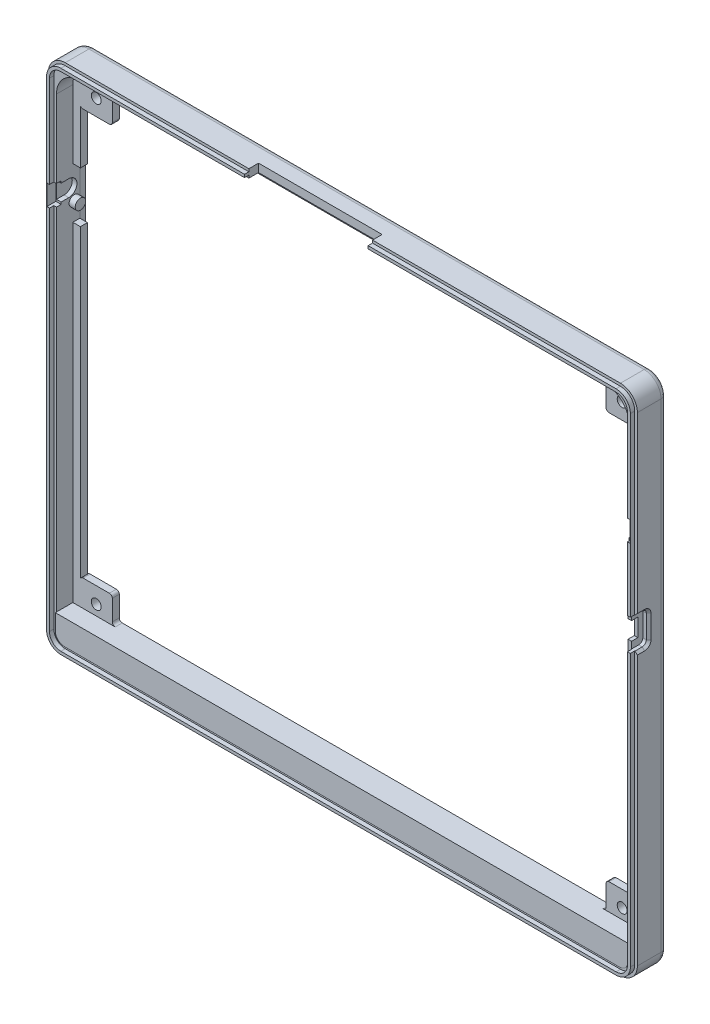
from build123d import *

# Parameters (mm, degrees)
PERIMETER_SHELL_START                     = -7.6
PERIMETER_SHELL_DEPTH                     = 5.6
OPEN_BACK_FRAME_START                     = -12.1
OPEN_BACK_FRAME_DEPTH                     = 4.5
PCB_MOUNT_WEB_0_START                     = -12.1
PCB_MOUNT_WEB_0_DEPTH                     = 4.5
PCB_M3_THROUGH_0_START                    = -7.5
PCB_M3_THROUGH_0_PROFILE_R                = 1.7
PCB_M3_THROUGH_0_DEPTH                    = 4.7
PCB_MOUNT_WEB_1_START                     = -12.1
PCB_MOUNT_WEB_1_DEPTH                     = 4.5
PCB_M3_THROUGH_1_START                    = -7.5
PCB_M3_THROUGH_1_PROFILE_R                = 1.7
PCB_M3_THROUGH_1_DEPTH                    = 4.7
PCB_MOUNT_WEB_2_START                     = -12.1
PCB_MOUNT_WEB_2_DEPTH                     = 4.5
PCB_M3_THROUGH_2_START                    = -7.5
PCB_M3_THROUGH_2_PROFILE_R                = 1.7
PCB_M3_THROUGH_2_DEPTH                    = 4.7
PCB_MOUNT_WEB_3_START                     = -12.1
PCB_MOUNT_WEB_3_DEPTH                     = 4.5
PCB_M3_THROUGH_3_START                    = -7.5
PCB_M3_THROUGH_3_PROFILE_R                = 1.7
PCB_M3_THROUGH_3_DEPTH                    = 4.7
REAR_GLASS_SEAT_START                     = -10
REAR_GLASS_SEAT_DEPTH                     = 2.2
PCB_LOWER_EDGE_WEB_START                  = -10
PCB_LOWER_EDGE_WEB_PROFILE_W              = 191
PCB_LOWER_EDGE_WEB_PROFILE_H              = 8.3
PCB_LOWER_EDGE_WEB_DEPTH                  = 8.4
PCB_SUPPORT_ROOT_ROUND_R                  = 1
LOCATING_TONGUE_START                     = -2
LOCATING_TONGUE_DEPTH                     = 1.5
TOP_CONNECTOR_ACCESS_START                = 14.29999894
TOP_CONNECTOR_ACCESS_PROFILE_W            = 42.3
TOP_CONNECTOR_ACCESS_PROFILE_H            = 13.3
TOP_CONNECTOR_ACCESS_DEPTH                = 19.6
POWER_RETAINING_WEB_START                 = -5.85
POWER_RETAINING_WEB_PROFILE_W             = 0.6
POWER_RETAINING_WEB_PROFILE_H             = 13.5
POWER_RETAINING_WEB_DEPTH                 = 3.85
SLIDER_SLOT_START                         = -0.35
SLIDER_SLOT_PROFILE_W                     = 7.8
SLIDER_SLOT_PROFILE_H                     = 6.1
SLIDER_SLOT_DEPTH                         = 3.8
POWER_THUMB_RECESS_START                  = 193.8
POWER_THUMB_RECESS_DEPTH                  = 3.4
INTERNAL_HINGE_CLEARANCE_0_START          = -1.9
INTERNAL_HINGE_CLEARANCE_0_PROFILE_W      = 7.2
INTERNAL_HINGE_CLEARANCE_0_PROFILE_H      = 17.4
INTERNAL_HINGE_CLEARANCE_0_DEPTH          = 10.3
INTERNAL_STOP_PIN_0_START                 = -3.5
INTERNAL_STOP_PIN_0_PROFILE_R             = 1.8
INTERNAL_STOP_PIN_0_DEPTH                 = 2.6
BLIND_AXLE_BEARING_0_START                = -4.6
BLIND_AXLE_BEARING_0_PROFILE_R            = 2.8
BLIND_AXLE_BEARING_0_DEPTH                = 1.7
AXLE_ASSEMBLY_ENTRY_0_START               = -4.6
AXLE_ASSEMBLY_ENTRY_0_PROFILE_W           = 6.3
AXLE_ASSEMBLY_ENTRY_0_PROFILE_H           = 5.6
AXLE_ASSEMBLY_ENTRY_0_DEPTH               = 1.7
KEEPER_SEAT_0_START                       = 0.1
KEEPER_SEAT_0_PROFILE_W                   = 2.1
KEEPER_SEAT_0_PROFILE_H                   = 7
KEEPER_SEAT_0_DEPTH                       = 3.7
INTERNAL_HINGE_CLEARANCE_1_START          = -1.9
INTERNAL_HINGE_CLEARANCE_1_PROFILE_W      = 7.2
INTERNAL_HINGE_CLEARANCE_1_PROFILE_H      = 17.4
INTERNAL_HINGE_CLEARANCE_1_DEPTH          = 10.3
INTERNAL_STOP_PIN_1_START                 = 190.9
INTERNAL_STOP_PIN_1_PROFILE_R             = 1.8
INTERNAL_STOP_PIN_1_DEPTH                 = 2.6
BLIND_AXLE_BEARING_1_START                = 192.9
BLIND_AXLE_BEARING_1_PROFILE_R            = 2.8
BLIND_AXLE_BEARING_1_DEPTH                = 1.7
AXLE_ASSEMBLY_ENTRY_1_START               = 192.9
AXLE_ASSEMBLY_ENTRY_1_PROFILE_W           = 6.3
AXLE_ASSEMBLY_ENTRY_1_PROFILE_H           = 5.6
AXLE_ASSEMBLY_ENTRY_1_DEPTH               = 1.7
KEEPER_SEAT_1_START                       = 0.1
KEEPER_SEAT_1_PROFILE_W                   = 2.1
KEEPER_SEAT_1_PROFILE_H                   = 7
KEEPER_SEAT_1_DEPTH                       = 3.7
OUTER_REAR_ROUND_R                        = 2
REAR_CORNER_FILL_0_START                  = -7.6
REAR_CORNER_FILL_0_PROFILE_W              = 9
REAR_CORNER_FILL_0_PROFILE_H              = 9
REAR_CORNER_FILL_0_DEPTH                  = 5.2
REAR_CORNER_RADIUS_0_START                = -2.3
REAR_CORNER_RADIUS_0_PROFILE_R            = 8
REAR_CORNER_RADIUS_0_DEPTH                = 5.3
REAR_CORNER_FILL_1_START                  = -7.6
REAR_CORNER_FILL_1_PROFILE_W              = 9
REAR_CORNER_FILL_1_PROFILE_H              = 9
REAR_CORNER_FILL_1_DEPTH                  = 5.2
REAR_CORNER_RADIUS_1_START                = -2.3
REAR_CORNER_RADIUS_1_PROFILE_R            = 8
REAR_CORNER_RADIUS_1_DEPTH                = 5.3
REAR_CORNER_FILL_2_START                  = -7.6
REAR_CORNER_FILL_2_PROFILE_W              = 9
REAR_CORNER_FILL_2_PROFILE_H              = 9
REAR_CORNER_FILL_2_DEPTH                  = 5.2
REAR_CORNER_RADIUS_2_START                = -2.3
REAR_CORNER_RADIUS_2_PROFILE_R            = 8
REAR_CORNER_RADIUS_2_DEPTH                = 5.3
REAR_CORNER_FILL_3_START                  = -7.6
REAR_CORNER_FILL_3_PROFILE_W              = 9
REAR_CORNER_FILL_3_PROFILE_H              = 9
REAR_CORNER_FILL_3_DEPTH                  = 5.2
REAR_CORNER_RADIUS_3_START                = -2.3
REAR_CORNER_RADIUS_3_PROFILE_R            = 8
REAR_CORNER_RADIUS_3_DEPTH                = 5.3
CORNER_LOWER_PCB_SUPPORT_START            = -10
CORNER_LOWER_PCB_SUPPORT_PROFILE_W        = 191
CORNER_LOWER_PCB_SUPPORT_PROFILE_H        = 8.3
CORNER_LOWER_PCB_SUPPORT_DEPTH            = 8.4
REAR_CORNER_FILL_0_EDGE_FLUSH_START       = -7.6
REAR_CORNER_FILL_0_EDGE_FLUSH_PROFILE_W   = 9
REAR_CORNER_FILL_0_EDGE_FLUSH_PROFILE_H   = 9
REAR_CORNER_FILL_0_EDGE_FLUSH_DEPTH       = 5.6
REAR_CORNER_RADIUS_0_EDGE_FLUSH_START     = -1.9
REAR_CORNER_RADIUS_0_EDGE_FLUSH_PROFILE_R = 8
REAR_CORNER_RADIUS_0_EDGE_FLUSH_DEPTH     = 5.7
REAR_CORNER_FILL_1_EDGE_FLUSH_START       = -7.6
REAR_CORNER_FILL_1_EDGE_FLUSH_PROFILE_W   = 9
REAR_CORNER_FILL_1_EDGE_FLUSH_PROFILE_H   = 9
REAR_CORNER_FILL_1_EDGE_FLUSH_DEPTH       = 5.6
REAR_CORNER_RADIUS_1_EDGE_FLUSH_START     = -1.9
REAR_CORNER_RADIUS_1_EDGE_FLUSH_PROFILE_R = 8
REAR_CORNER_RADIUS_1_EDGE_FLUSH_DEPTH     = 5.7
REAR_CORNER_FILL_2_EDGE_FLUSH_START       = -7.6
REAR_CORNER_FILL_2_EDGE_FLUSH_PROFILE_W   = 9
REAR_CORNER_FILL_2_EDGE_FLUSH_PROFILE_H   = 9
REAR_CORNER_FILL_2_EDGE_FLUSH_DEPTH       = 5.6
REAR_CORNER_RADIUS_2_EDGE_FLUSH_START     = -1.9
REAR_CORNER_RADIUS_2_EDGE_FLUSH_PROFILE_R = 8
REAR_CORNER_RADIUS_2_EDGE_FLUSH_DEPTH     = 5.7
REAR_CORNER_FILL_3_EDGE_FLUSH_START       = -7.6
REAR_CORNER_FILL_3_EDGE_FLUSH_PROFILE_W   = 9
REAR_CORNER_FILL_3_EDGE_FLUSH_PROFILE_H   = 9
REAR_CORNER_FILL_3_EDGE_FLUSH_DEPTH       = 5.6
REAR_CORNER_RADIUS_3_EDGE_FLUSH_START     = -1.9
REAR_CORNER_RADIUS_3_EDGE_FLUSH_PROFILE_R = 8
REAR_CORNER_RADIUS_3_EDGE_FLUSH_DEPTH     = 5.7
PCB_SUPPORT_EDGE_FINISH_START             = -10
PCB_SUPPORT_EDGE_FINISH_DEPTH             = 8.4


with BuildPart() as part:
    # Perimeter_shell_profile → Perimeter_shell (new body)
    with BuildSketch(Plane.XY.offset(PERIMETER_SHELL_START)):
        with BuildLine():
            Line((0, -9.8), (190, -9.8))
            ThreePointArc((190, -9.8), (194.101219331, -8.101219331), (195.8, -4))
            Line((195.8, -4), (195.8, 160))
            ThreePointArc((195.8, 160), (194.101219331, 164.101219331), (190, 165.8))
            Line((190, 165.8), (0, 165.8))
            ThreePointArc((0, 165.8), (-4.101219331, 164.101219331), (-5.8, 160))
            Line((-5.8, 160), (-5.8, -4))
            ThreePointArc((-5.8, -4), (-4.101219331, -8.101219331), (0, -9.8))
        make_face()
        with BuildLine():
            Line((0, -7), (190, -7))
            ThreePointArc((190, -7), (192.121320344, -6.121320344), (193, -4))
            Line((193, -4), (193, 160))
            ThreePointArc((193, 160), (192.121320344, 162.121320344), (190, 163))
            Line((190, 163), (0, 163))
            ThreePointArc((0, 163), (-2.121320344, 162.121320344), (-3, 160))
            Line((-3, 160), (-3, -4))
            ThreePointArc((-3, -4), (-2.121320344, -6.121320344), (0, -7))
        make_face(mode=Mode.SUBTRACT)
    extrude(amount=PERIMETER_SHELL_DEPTH)

    # Open_back_frame_profile → Open_back_frame (add)
    with BuildSketch(Plane.XY.offset(OPEN_BACK_FRAME_START)):
        with BuildLine():
            Line((0, -9.8), (190, -9.8))
            ThreePointArc((190, -9.8), (194.101219331, -8.101219331), (195.8, -4))
            Line((195.8, -4), (195.8, 160))
            ThreePointArc((195.8, 160), (194.101219331, 164.101219331), (190, 165.8))
            Line((190, 165.8), (0, 165.8))
            ThreePointArc((0, 165.8), (-4.101219331, 164.101219331), (-5.8, 160))
            Line((-5.8, 160), (-5.8, -4))
            ThreePointArc((-5.8, -4), (-4.101219331, -8.101219331), (0, -9.8))
        make_face()
        with BuildLine():
            Line((1.6, -4.4), (188.4, -4.4))
            ThreePointArc((188.4, -4.4), (189.814213562, -3.814213562), (190.4, -2.4))
            Line((190.4, -2.4), (190.4, 158.4))
            ThreePointArc((190.4, 158.4), (189.814213562, 159.814213562), (188.4, 160.4))
            Line((188.4, 160.4), (1.6, 160.4))
            ThreePointArc((1.6, 160.4), (0.185786438, 159.814213562), (-0.4, 158.4))
            Line((-0.4, 158.4), (-0.4, -2.4))
            ThreePointArc((-0.4, -2.4), (0.185786438, -3.814213562), (1.6, -4.4))
        make_face(mode=Mode.SUBTRACT)
    extrude(amount=OPEN_BACK_FRAME_DEPTH)

    # PCB_mount_web_0_profile → PCB_mount_web_0 (add)
    with BuildSketch(Plane.XY.offset(PCB_MOUNT_WEB_0_START)):
        with BuildLine():
            Line((0.5, -6), (9.5, -6))
            ThreePointArc((9.5, -6), (10.207106781, -5.707106781), (10.5, -5))
            Line((10.5, -5), (10.5, 9.5))
            ThreePointArc((10.5, 9.5), (10.207106781, 10.207106781), (9.5, 10.5))
            Line((9.5, 10.5), (0.5, 10.5))
            ThreePointArc((0.5, 10.5), (-0.207106781, 10.207106781), (-0.5, 9.5))
            Line((-0.5, 9.5), (-0.5, -5))
            ThreePointArc((-0.5, -5), (-0.207106781, -5.707106781), (0.5, -6))
        make_face()
    extrude(amount=PCB_MOUNT_WEB_0_DEPTH)

    # PCB_M3_through_0_profile → PCB_M3_through_0 (cut)
    with BuildSketch(Plane.XY.offset(PCB_M3_THROUGH_0_START)):
        with Locations((5, 5)):
            Circle(PCB_M3_THROUGH_0_PROFILE_R)
    extrude(amount=-PCB_M3_THROUGH_0_DEPTH, mode=Mode.SUBTRACT)

    # PCB_mount_web_1_profile → PCB_mount_web_1 (add)
    with BuildSketch(Plane.XY.offset(PCB_MOUNT_WEB_1_START)):
        with BuildLine():
            Line((180.5, -6), (189.5, -6))
            ThreePointArc((189.5, -6), (190.207106781, -5.707106781), (190.5, -5))
            Line((190.5, -5), (190.5, 9.5))
            ThreePointArc((190.5, 9.5), (190.207106781, 10.207106781), (189.5, 10.5))
            Line((189.5, 10.5), (180.5, 10.5))
            ThreePointArc((180.5, 10.5), (179.792893219, 10.207106781), (179.5, 9.5))
            Line((179.5, 9.5), (179.5, -5))
            ThreePointArc((179.5, -5), (179.792893219, -5.707106781), (180.5, -6))
        make_face()
    extrude(amount=PCB_MOUNT_WEB_1_DEPTH)

    # PCB_M3_through_1_profile → PCB_M3_through_1 (cut)
    with BuildSketch(Plane.XY.offset(PCB_M3_THROUGH_1_START)):
        with Locations((185, 5)):
            Circle(PCB_M3_THROUGH_1_PROFILE_R)
    extrude(amount=-PCB_M3_THROUGH_1_DEPTH, mode=Mode.SUBTRACT)

    # PCB_mount_web_2_profile → PCB_mount_web_2 (add)
    with BuildSketch(Plane.XY.offset(PCB_MOUNT_WEB_2_START)):
        with BuildLine():
            Line((0.5, 149.5), (9.5, 149.5))
            ThreePointArc((9.5, 149.5), (10.207106781, 149.792893219), (10.5, 150.5))
            Line((10.5, 150.5), (10.5, 161))
            ThreePointArc((10.5, 161), (10.207106781, 161.707106781), (9.5, 162))
            Line((9.5, 162), (0.5, 162))
            ThreePointArc((0.5, 162), (-0.207106781, 161.707106781), (-0.5, 161))
            Line((-0.5, 161), (-0.5, 150.5))
            ThreePointArc((-0.5, 150.5), (-0.207106781, 149.792893219), (0.5, 149.5))
        make_face()
    extrude(amount=PCB_MOUNT_WEB_2_DEPTH)

    # PCB_M3_through_2_profile → PCB_M3_through_2 (cut)
    with BuildSketch(Plane.XY.offset(PCB_M3_THROUGH_2_START)):
        with Locations((5, 155)):
            Circle(PCB_M3_THROUGH_2_PROFILE_R)
    extrude(amount=-PCB_M3_THROUGH_2_DEPTH, mode=Mode.SUBTRACT)

    # PCB_mount_web_3_profile → PCB_mount_web_3 (add)
    with BuildSketch(Plane.XY.offset(PCB_MOUNT_WEB_3_START)):
        with BuildLine():
            Line((180.5, 149.5), (189.5, 149.5))
            ThreePointArc((189.5, 149.5), (190.207106781, 149.792893219), (190.5, 150.5))
            Line((190.5, 150.5), (190.5, 161))
            ThreePointArc((190.5, 161), (190.207106781, 161.707106781), (189.5, 162))
            Line((189.5, 162), (180.5, 162))
            ThreePointArc((180.5, 162), (179.792893219, 161.707106781), (179.5, 161))
            Line((179.5, 161), (179.5, 150.5))
            ThreePointArc((179.5, 150.5), (179.792893219, 149.792893219), (180.5, 149.5))
        make_face()
    extrude(amount=PCB_MOUNT_WEB_3_DEPTH)

    # PCB_M3_through_3_profile → PCB_M3_through_3 (cut)
    with BuildSketch(Plane.XY.offset(PCB_M3_THROUGH_3_START)):
        with Locations((185, 155)):
            Circle(PCB_M3_THROUGH_3_PROFILE_R)
    extrude(amount=-PCB_M3_THROUGH_3_DEPTH, mode=Mode.SUBTRACT)

    # Rear_glass_seat_profile → Rear_glass_seat (cut)
    with BuildSketch(Plane.XY.offset(REAR_GLASS_SEAT_START)):
        with BuildLine():
            Line((0, -7.25), (190, -7.25))
            ThreePointArc((190, -7.25), (192.298097039, -6.298097039), (193.25, -4))
            Line((193.25, -4), (193.25, 160))
            ThreePointArc((193.25, 160), (192.298097039, 162.298097039), (190, 163.25))
            Line((190, 163.25), (0, 163.25))
            ThreePointArc((0, 163.25), (-2.298097039, 162.298097039), (-3.25, 160))
            Line((-3.25, 160), (-3.25, -4))
            ThreePointArc((-3.25, -4), (-2.298097039, -6.298097039), (0, -7.25))
        make_face()
    extrude(amount=-REAR_GLASS_SEAT_DEPTH, mode=Mode.SUBTRACT)

    # PCB_lower_edge_web_profile → PCB_lower_edge_web (add)
    with BuildSketch(Plane.XY.offset(PCB_LOWER_EDGE_WEB_START)):
        with Locations((95, -2.65)):
            Rectangle(PCB_LOWER_EDGE_WEB_PROFILE_W, PCB_LOWER_EDGE_WEB_PROFILE_H)
    extrude(amount=PCB_LOWER_EDGE_WEB_DEPTH)

    # PCB_support_root_round
    pcb_support_root_round_edges = [part.edges().sort_by_distance(p)[0] for p in [
        (179.5, 1.5, -8.8),
        (10.5, 1.5, -8.8),
    ]]
    fillet(pcb_support_root_round_edges, radius=PCB_SUPPORT_ROOT_ROUND_R)

    # Locating_tongue_profile → Locating_tongue (add)
    with BuildSketch(Plane.XY.offset(LOCATING_TONGUE_START)):
        with BuildLine():
            Line((0, -8.9), (190, -8.9))
            ThreePointArc((190, -8.9), (193.464823228, -7.464823228), (194.9, -4))
            Line((194.9, -4), (194.9, 160))
            ThreePointArc((194.9, 160), (193.464823228, 163.464823228), (190, 164.9))
            Line((190, 164.9), (0, 164.9))
            ThreePointArc((0, 164.9), (-3.464823228, 163.464823228), (-4.9, 160))
            Line((-4.9, 160), (-4.9, -4))
            ThreePointArc((-4.9, -4), (-3.464823228, -7.464823228), (0, -8.9))
        make_face()
        with BuildLine():
            Line((0, -7.9), (190, -7.9))
            ThreePointArc((190, -7.9), (192.757716447, -6.757716447), (193.9, -4))
            Line((193.9, -4), (193.9, 160))
            ThreePointArc((193.9, 160), (192.757716447, 162.757716447), (190, 163.9))
            Line((190, 163.9), (0, 163.9))
            ThreePointArc((0, 163.9), (-2.757716447, 162.757716447), (-3.9, 160))
            Line((-3.9, 160), (-3.9, -4))
            ThreePointArc((-3.9, -4), (-2.757716447, -6.757716447), (0, -7.9))
        make_face(mode=Mode.SUBTRACT)
    extrude(amount=LOCATING_TONGUE_DEPTH)

    # Top_connector_access_profile → Top_connector_access (cut)
    with BuildSketch(Plane.XY.offset(TOP_CONNECTOR_ACCESS_START)):
        with Locations((84.0000633, 160.15)):
            Rectangle(TOP_CONNECTOR_ACCESS_PROFILE_W, TOP_CONNECTOR_ACCESS_PROFILE_H)
    extrude(amount=-TOP_CONNECTOR_ACCESS_DEPTH, mode=Mode.SUBTRACT)

    # Power_retaining_web_profile → Power_retaining_web (add)
    with BuildSketch(Plane.XY.offset(POWER_RETAINING_WEB_START)):
        with Locations((192.9, 94.25)):
            Rectangle(POWER_RETAINING_WEB_PROFILE_W, POWER_RETAINING_WEB_PROFILE_H)
    extrude(amount=POWER_RETAINING_WEB_DEPTH)

    # Slider_slot_profile → Slider_slot (cut)
    with BuildSketch(Plane.XY.offset(SLIDER_SLOT_START)):
        with Locations((193.1, 94.27)):
            Rectangle(SLIDER_SLOT_PROFILE_W, SLIDER_SLOT_PROFILE_H)
    extrude(amount=-SLIDER_SLOT_DEPTH, mode=Mode.SUBTRACT)

    # Power_thumb_recess_profile → Power_thumb_recess (cut)
    with BuildSketch(Plane(origin=(0, 0, 0), x_dir=(0, 0, -1), z_dir=(1, 0, 0)).offset(POWER_THUMB_RECESS_START)):
        with BuildLine():
            Line((5.85, 90.32), (5.85, 98.22))
            ThreePointArc((5.85, 98.22), (5.439949494, 99.209949494), (4.45, 99.62))
            Line((4.45, 99.62), (0.05, 99.62))
            ThreePointArc((0.05, 99.62), (-0.939949494, 99.209949494), (-1.35, 98.22))
            Line((-1.35, 98.22), (-1.35, 90.32))
            ThreePointArc((-1.35, 90.32), (-0.939949494, 89.330050506), (0.05, 88.92))
            Line((0.05, 88.92), (4.45, 88.92))
            ThreePointArc((4.45, 88.92), (5.439949494, 89.330050506), (5.85, 90.32))
        make_face()
    extrude(amount=POWER_THUMB_RECESS_DEPTH, mode=Mode.SUBTRACT)

    # Power_recess_bevel_secti for Power_reces → Power_recess_bevel section 0
    with BuildSketch(Plane(origin=(195, 0, 0), x_dir=(0, 0, -1), z_dir=(1, 0, 0))):
        with BuildLine():
            Line((5.85, 90.32), (5.85, 98.22))
            # circular arc as an exact rational Bezier (weights 1, cos(half-angle), 1)
            Bezier((5.85, 98.22), (5.85, 99.62), (4.45, 99.62), weights=[1, 0.707106781, 1])
            Line((4.45, 99.62), (0.05, 99.62))
            Bezier((0.05, 99.62), (-1.35, 99.62), (-1.35, 98.22), weights=[1, 0.707106781, 1])
            Line((-1.35, 98.22), (-1.35, 90.32))
            Bezier((-1.35, 90.32), (-1.35, 88.92), (0.05, 88.92), weights=[1, 0.707106781, 1])
            Line((0.05, 88.92), (4.45, 88.92))
            Bezier((4.45, 88.92), (5.85, 88.92), (5.85, 90.32), weights=[1, 0.707106781, 1])
        make_face()
    # Power_recess_bevel_secti for Power_r 2 → Power_recess_bevel section 1
    with BuildSketch(Plane(origin=(195.8, 0, 0), x_dir=(0, 0, -1), z_dir=(1, 0, 0))):
        with BuildLine():
            Line((6.65, 90.32), (6.65, 98.22))
            Bezier((6.65, 98.22), (6.65, 100.42), (4.45, 100.42), weights=[1, 0.707106781, 1])
            Line((4.45, 100.42), (0.05, 100.42))
            Bezier((0.05, 100.42), (-2.15, 100.42), (-2.15, 98.22), weights=[1, 0.707106781, 1])
            Line((-2.15, 98.22), (-2.15, 90.32))
            Bezier((-2.15, 90.32), (-2.15, 88.12), (0.05, 88.12), weights=[1, 0.707106781, 1])
            Line((0.05, 88.12), (4.45, 88.12))
            Bezier((4.45, 88.12), (6.65, 88.12), (6.65, 90.32), weights=[1, 0.707106781, 1])
        make_face()
    loft(mode=Mode.SUBTRACT)

    # Internal_hinge_clearance_0_profile → Internal_hinge_clearance_0 (cut)
    with BuildSketch(Plane.XY.offset(INTERNAL_HINGE_CLEARANCE_0_START)):
        with Locations((0.6, 122.9)):
            Rectangle(INTERNAL_HINGE_CLEARANCE_0_PROFILE_W, INTERNAL_HINGE_CLEARANCE_0_PROFILE_H)
    extrude(amount=-INTERNAL_HINGE_CLEARANCE_0_DEPTH, mode=Mode.SUBTRACT)

    # Internal_stop_pin_0_profile → Internal_stop_pin_0 (add)
    with BuildSketch(Plane(origin=(0, 0, 0), x_dir=(0, 0, -1), z_dir=(1, 0, 0)).offset(INTERNAL_STOP_PIN_0_START)):
        with Locations((8.113417162, 120.380602337)):
            Circle(INTERNAL_STOP_PIN_0_PROFILE_R)
    extrude(amount=INTERNAL_STOP_PIN_0_DEPTH)

    # Blind_axle_bearing_0_profile → Blind_axle_bearing_0 (cut)
    with BuildSketch(Plane(origin=(0, 0, 0), x_dir=(0, 0, -1), z_dir=(1, 0, 0)).offset(BLIND_AXLE_BEARING_0_START)):
        with Locations((6.2, 125)):
            Circle(BLIND_AXLE_BEARING_0_PROFILE_R)
    extrude(amount=BLIND_AXLE_BEARING_0_DEPTH, mode=Mode.SUBTRACT)

    # Axle_assembly_entry_0_profile → Axle_assembly_entry_0 (cut)
    with BuildSketch(Plane(origin=(0, 0, 0), x_dir=(0, 0, -1), z_dir=(1, 0, 0)).offset(AXLE_ASSEMBLY_ENTRY_0_START)):
        with Locations((3.05, 125)):
            Rectangle(AXLE_ASSEMBLY_ENTRY_0_PROFILE_W, AXLE_ASSEMBLY_ENTRY_0_PROFILE_H)
    extrude(amount=AXLE_ASSEMBLY_ENTRY_0_DEPTH, mode=Mode.SUBTRACT)

    # Keeper_seat_0_profile → Keeper_seat_0 (cut)
    with BuildSketch(Plane.XY.offset(KEEPER_SEAT_0_START)):
        with Locations((-3.75, 125)):
            Rectangle(KEEPER_SEAT_0_PROFILE_W, KEEPER_SEAT_0_PROFILE_H)
    extrude(amount=-KEEPER_SEAT_0_DEPTH, mode=Mode.SUBTRACT)

    # Internal_hinge_clearance_1_profile → Internal_hinge_clearance_1 (cut)
    with BuildSketch(Plane.XY.offset(INTERNAL_HINGE_CLEARANCE_1_START)):
        with Locations((189.4, 122.9)):
            Rectangle(INTERNAL_HINGE_CLEARANCE_1_PROFILE_W, INTERNAL_HINGE_CLEARANCE_1_PROFILE_H)
    extrude(amount=-INTERNAL_HINGE_CLEARANCE_1_DEPTH, mode=Mode.SUBTRACT)

    # Internal_stop_pin_1_profile → Internal_stop_pin_1 (add)
    with BuildSketch(Plane(origin=(0, 0, 0), x_dir=(0, 0, -1), z_dir=(1, 0, 0)).offset(INTERNAL_STOP_PIN_1_START)):
        with Locations((8.113417162, 120.380602337)):
            Circle(INTERNAL_STOP_PIN_1_PROFILE_R)
    extrude(amount=INTERNAL_STOP_PIN_1_DEPTH)

    # Blind_axle_bearing_1_profile → Blind_axle_bearing_1 (cut)
    with BuildSketch(Plane(origin=(0, 0, 0), x_dir=(0, 0, -1), z_dir=(1, 0, 0)).offset(BLIND_AXLE_BEARING_1_START)):
        with Locations((6.2, 125)):
            Circle(BLIND_AXLE_BEARING_1_PROFILE_R)
    extrude(amount=BLIND_AXLE_BEARING_1_DEPTH, mode=Mode.SUBTRACT)

    # Axle_assembly_entry_1_profile → Axle_assembly_entry_1 (cut)
    with BuildSketch(Plane(origin=(0, 0, 0), x_dir=(0, 0, -1), z_dir=(1, 0, 0)).offset(AXLE_ASSEMBLY_ENTRY_1_START)):
        with Locations((3.05, 125)):
            Rectangle(AXLE_ASSEMBLY_ENTRY_1_PROFILE_W, AXLE_ASSEMBLY_ENTRY_1_PROFILE_H)
    extrude(amount=AXLE_ASSEMBLY_ENTRY_1_DEPTH, mode=Mode.SUBTRACT)

    # Keeper_seat_1_profile → Keeper_seat_1 (cut)
    with BuildSketch(Plane.XY.offset(KEEPER_SEAT_1_START)):
        with Locations((193.75, 125)):
            Rectangle(KEEPER_SEAT_1_PROFILE_W, KEEPER_SEAT_1_PROFILE_H)
    extrude(amount=-KEEPER_SEAT_1_DEPTH, mode=Mode.SUBTRACT)

    # Outer_rear_round
    outer_rear_round_edges = [part.edges().sort_by_distance(p)[0] for p in [
        (-4.101219331, -8.101219331, -12.1),
        (95, -9.8, -12.1),
        (194.101219331, -8.101219331, -12.1),
        (195.8, 78, -12.1),
        (194.101219331, 164.101219331, -12.1),
        (95, 165.8, -12.1),
        (-4.101219331, 164.101219331, -12.1),
        (-5.8, 78, -12.1),
    ]]
    fillet(outer_rear_round_edges, radius=OUTER_REAR_ROUND_R)

    # Rear_corner_fill_0_profile → Rear_corner_fill_0 (add)
    with BuildSketch(Plane.XY.offset(REAR_CORNER_FILL_0_START)):
        with Locations((0.5, -3.5)):
            Rectangle(REAR_CORNER_FILL_0_PROFILE_W, REAR_CORNER_FILL_0_PROFILE_H)
    extrude(amount=REAR_CORNER_FILL_0_DEPTH)

    # Rear_corner_radius_0_profile → Rear_corner_radius_0 (cut)
    with BuildSketch(Plane.XY.offset(REAR_CORNER_RADIUS_0_START)):
        with Locations((5, 1)):
            Circle(REAR_CORNER_RADIUS_0_PROFILE_R)
    extrude(amount=-REAR_CORNER_RADIUS_0_DEPTH, mode=Mode.SUBTRACT)

    # Rear_corner_fill_1_profile → Rear_corner_fill_1 (add)
    with BuildSketch(Plane.XY.offset(REAR_CORNER_FILL_1_START)):
        with Locations((189.5, -3.5)):
            Rectangle(REAR_CORNER_FILL_1_PROFILE_W, REAR_CORNER_FILL_1_PROFILE_H)
    extrude(amount=REAR_CORNER_FILL_1_DEPTH)

    # Rear_corner_radius_1_profile → Rear_corner_radius_1 (cut)
    with BuildSketch(Plane.XY.offset(REAR_CORNER_RADIUS_1_START)):
        with Locations((185, 1)):
            Circle(REAR_CORNER_RADIUS_1_PROFILE_R)
    extrude(amount=-REAR_CORNER_RADIUS_1_DEPTH, mode=Mode.SUBTRACT)

    # Rear_corner_fill_2_profile → Rear_corner_fill_2 (add)
    with BuildSketch(Plane.XY.offset(REAR_CORNER_FILL_2_START)):
        with Locations((0.5, 159.5)):
            Rectangle(REAR_CORNER_FILL_2_PROFILE_W, REAR_CORNER_FILL_2_PROFILE_H)
    extrude(amount=REAR_CORNER_FILL_2_DEPTH)

    # Rear_corner_radius_2_profile → Rear_corner_radius_2 (cut)
    with BuildSketch(Plane.XY.offset(REAR_CORNER_RADIUS_2_START)):
        with Locations((5, 155)):
            Circle(REAR_CORNER_RADIUS_2_PROFILE_R)
    extrude(amount=-REAR_CORNER_RADIUS_2_DEPTH, mode=Mode.SUBTRACT)

    # Rear_corner_fill_3_profile → Rear_corner_fill_3 (add)
    with BuildSketch(Plane.XY.offset(REAR_CORNER_FILL_3_START)):
        with Locations((189.5, 159.5)):
            Rectangle(REAR_CORNER_FILL_3_PROFILE_W, REAR_CORNER_FILL_3_PROFILE_H)
    extrude(amount=REAR_CORNER_FILL_3_DEPTH)

    # Rear_corner_radius_3_profile → Rear_corner_radius_3 (cut)
    with BuildSketch(Plane.XY.offset(REAR_CORNER_RADIUS_3_START)):
        with Locations((185, 155)):
            Circle(REAR_CORNER_RADIUS_3_PROFILE_R)
    extrude(amount=-REAR_CORNER_RADIUS_3_DEPTH, mode=Mode.SUBTRACT)

    # Corner_lower_PCB_support_profile → Corner_lower_PCB_support (add)
    with BuildSketch(Plane.XY.offset(CORNER_LOWER_PCB_SUPPORT_START)):
        with Locations((95, -2.65)):
            Rectangle(CORNER_LOWER_PCB_SUPPORT_PROFILE_W, CORNER_LOWER_PCB_SUPPORT_PROFILE_H)
    extrude(amount=CORNER_LOWER_PCB_SUPPORT_DEPTH)

    # Rear_corner_fill_0_edge_flush_profile → Rear_corner_fill_0_edge_flush (add)
    with BuildSketch(Plane.XY.offset(REAR_CORNER_FILL_0_EDGE_FLUSH_START)):
        with Locations((0.5, -3.5)):
            Rectangle(REAR_CORNER_FILL_0_EDGE_FLUSH_PROFILE_W, REAR_CORNER_FILL_0_EDGE_FLUSH_PROFILE_H)
    extrude(amount=REAR_CORNER_FILL_0_EDGE_FLUSH_DEPTH)

    # Rear_corner_radius_0_edge_flush_profile → Rear_corner_radius_0_edge_flush (cut)
    with BuildSketch(Plane.XY.offset(REAR_CORNER_RADIUS_0_EDGE_FLUSH_START)):
        with Locations((5, 1)):
            Circle(REAR_CORNER_RADIUS_0_EDGE_FLUSH_PROFILE_R)
    extrude(amount=-REAR_CORNER_RADIUS_0_EDGE_FLUSH_DEPTH, mode=Mode.SUBTRACT)

    # Rear_corner_fill_1_edge_flush_profile → Rear_corner_fill_1_edge_flush (add)
    with BuildSketch(Plane.XY.offset(REAR_CORNER_FILL_1_EDGE_FLUSH_START)):
        with Locations((189.5, -3.5)):
            Rectangle(REAR_CORNER_FILL_1_EDGE_FLUSH_PROFILE_W, REAR_CORNER_FILL_1_EDGE_FLUSH_PROFILE_H)
    extrude(amount=REAR_CORNER_FILL_1_EDGE_FLUSH_DEPTH)

    # Rear_corner_radius_1_edge_flush_profile → Rear_corner_radius_1_edge_flush (cut)
    with BuildSketch(Plane.XY.offset(REAR_CORNER_RADIUS_1_EDGE_FLUSH_START)):
        with Locations((185, 1)):
            Circle(REAR_CORNER_RADIUS_1_EDGE_FLUSH_PROFILE_R)
    extrude(amount=-REAR_CORNER_RADIUS_1_EDGE_FLUSH_DEPTH, mode=Mode.SUBTRACT)

    # Rear_corner_fill_2_edge_flush_profile → Rear_corner_fill_2_edge_flush (add)
    with BuildSketch(Plane.XY.offset(REAR_CORNER_FILL_2_EDGE_FLUSH_START)):
        with Locations((0.5, 159.5)):
            Rectangle(REAR_CORNER_FILL_2_EDGE_FLUSH_PROFILE_W, REAR_CORNER_FILL_2_EDGE_FLUSH_PROFILE_H)
    extrude(amount=REAR_CORNER_FILL_2_EDGE_FLUSH_DEPTH)

    # Rear_corner_radius_2_edge_flush_profile → Rear_corner_radius_2_edge_flush (cut)
    with BuildSketch(Plane.XY.offset(REAR_CORNER_RADIUS_2_EDGE_FLUSH_START)):
        with Locations((5, 155)):
            Circle(REAR_CORNER_RADIUS_2_EDGE_FLUSH_PROFILE_R)
    extrude(amount=-REAR_CORNER_RADIUS_2_EDGE_FLUSH_DEPTH, mode=Mode.SUBTRACT)

    # Rear_corner_fill_3_edge_flush_profile → Rear_corner_fill_3_edge_flush (add)
    with BuildSketch(Plane.XY.offset(REAR_CORNER_FILL_3_EDGE_FLUSH_START)):
        with Locations((189.5, 159.5)):
            Rectangle(REAR_CORNER_FILL_3_EDGE_FLUSH_PROFILE_W, REAR_CORNER_FILL_3_EDGE_FLUSH_PROFILE_H)
    extrude(amount=REAR_CORNER_FILL_3_EDGE_FLUSH_DEPTH)

    # Rear_corner_radius_3_edge_flush_profile → Rear_corner_radius_3_edge_flush (cut)
    with BuildSketch(Plane.XY.offset(REAR_CORNER_RADIUS_3_EDGE_FLUSH_START)):
        with Locations((185, 155)):
            Circle(REAR_CORNER_RADIUS_3_EDGE_FLUSH_PROFILE_R)
    extrude(amount=-REAR_CORNER_RADIUS_3_EDGE_FLUSH_DEPTH, mode=Mode.SUBTRACT)

    # PCB_support_edge_finish_profile → PCB_support_edge_finish (add)
    with BuildSketch(Plane.XY.offset(PCB_SUPPORT_EDGE_FINISH_START)):
        with BuildLine():
            Line((193, 1.5), (-3, 1.5))
            Line((-3, 1.5), (-3, -4))
            ThreePointArc((-3, -4), (-2.121320344, -6.121320344), (0, -7))
            Line((0, -7), (190, -7))
            ThreePointArc((190, -7), (192.121320344, -6.121320344), (193, -4))
            Line((193, -4), (193, 1.5))
        make_face()
    extrude(amount=PCB_SUPPORT_EDGE_FINISH_DEPTH)


solid = part.part
